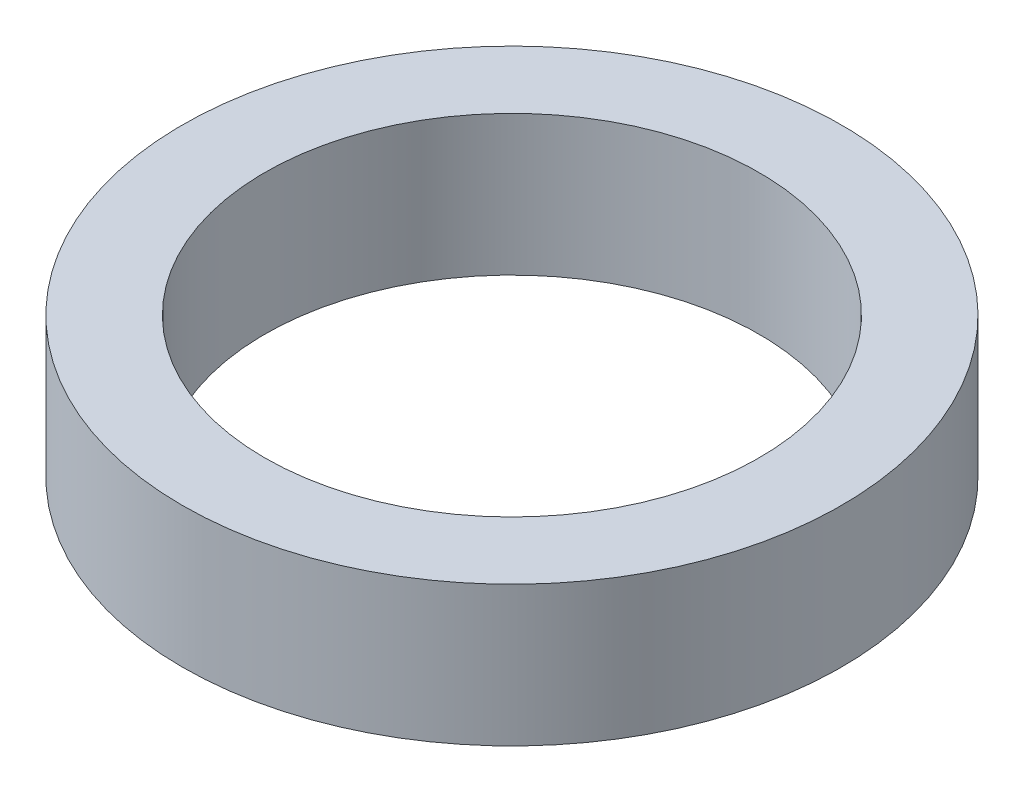
from build123d import *

# Parameters (mm, degrees)
SKETCH1_R           = 40
BOSS_EXTRUDE1_DEPTH = 17
SKETCH2_R           = 30
CUT_EXTRUDE1_DEPTH  = 60.067757702


with BuildPart() as part:
    # Sketch1 → Boss-Extrude1 (new body)
    with BuildSketch(Plane(origin=(0, 0, 0), x_dir=(1, 0, 0), z_dir=(0, 1, 0))):
        Circle(SKETCH1_R)
    extrude(amount=BOSS_EXTRUDE1_DEPTH)

    # Sketch2 → Cut-Extrude1 (cut, through all)
    with BuildSketch(Plane(origin=(0, 0, 0), x_dir=(1, 0, 0), z_dir=(0, 1, 0))):
        Circle(SKETCH2_R)
    extrude(amount=CUT_EXTRUDE1_DEPTH, mode=Mode.SUBTRACT)


solid = part.part
